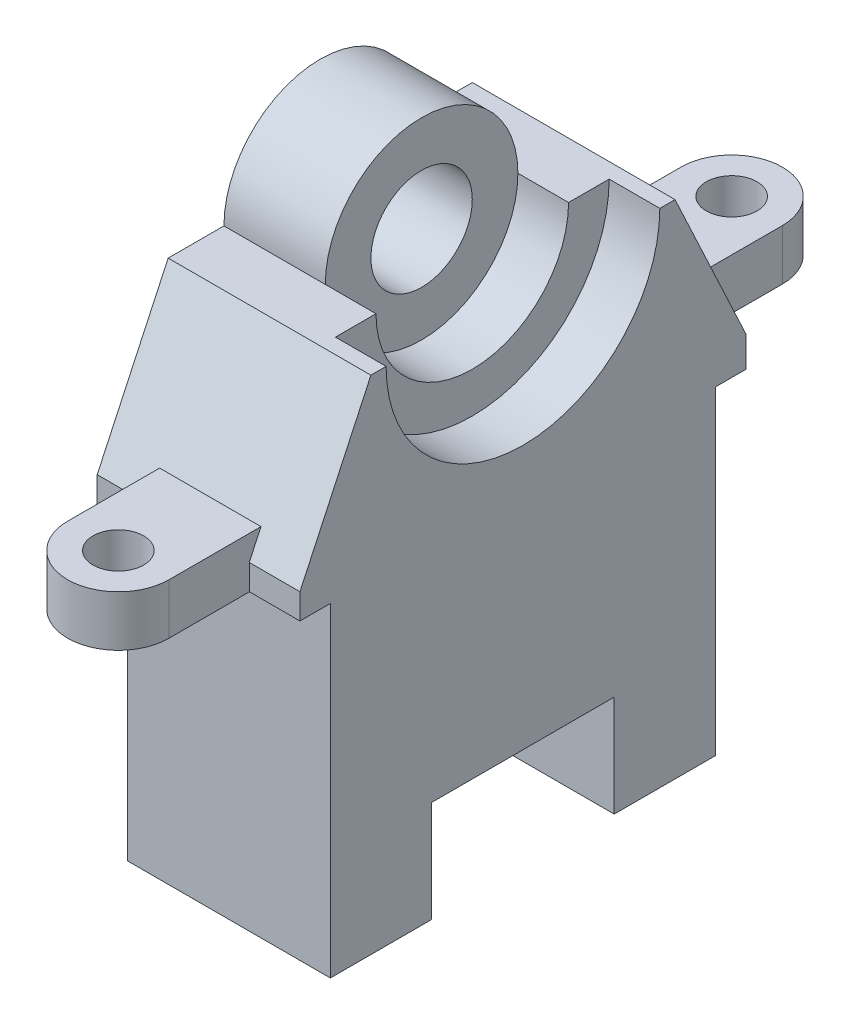
from build123d import *

# Parameters (mm, degrees)
BOSS_EXTRUDE1_DEPTH      = 40
BOSS_EXTRUDE2_DEPTH      = 110
BOSS_EXTRUDE2_DEPTH_BACK = 31
SKETCH11_R               = 5
CUT_EXTRUDE11_DEPTH      = 30
SKETCH12_R               = 5
CUT_EXTRUDE15_DEPTH      = 84
SKETCH5_W                = 36
SKETCH5_H                = 20
CUT_EXTRUDE3_DEPTH       = 43
BOSS_EXTRUDE6_DEPTH      = 40
CUT_EXTRUDE4_START       = -10
SKETCH6_R                = 27
CUT_EXTRUDE4_DEPTH       = 10
CUT_EXTRUDE7_START       = -10
CUT_EXTRUDE7_DEPTH       = 10
CUT_EXTRUDE8_START       = -20
CUT_EXTRUDE8_DEPTH       = 20
SKETCH10_R               = 10
CUT_EXTRUDE9_DEPTH       = 20


# Read off the part's stored shape, not the designer's step: Boss-Extrude6
with BuildPart() as part:
    # Sketch1 → Boss-Extrude1 (new body)
    with BuildSketch(Plane(origin=(0, 0, 0), x_dir=(0, 0, -1), z_dir=(1, 0, 0))):
        Polygon((-38.7187028, -36.676276186), (37.2812972, -36.676276186), (37.2812972, 26.323723814), (43.2812972, 26.323723814), (43.2812972, 32.323723814), (29.2812972, 62.323723814), (-30.7187028, 62.323723814), (-44.7187028, 32.323723814), (-44.7187028, 27.323723814), (-38.7187028, 27.323723814), align=None)
    extrude(amount=BOSS_EXTRUDE1_DEPTH)

    # 3DSketch1 → Boss-Extrude2 (add, two sides: drawn at the far end of the back side and taken through both)
    with BuildSketch(Plane(origin=(30, 37.289381844, 39.546748703), x_dir=(-0.8944271909999159, -0.44721359549995804, 0), z_dir=(0, 0, -1)).offset(-BOSS_EXTRUDE2_DEPTH_BACK)):
        Polygon((0, 0), (17.88854382, 8.94427191), (22.360679775, 0), (4.472135955, -8.94427191), align=None)
    extrude(amount=BOSS_EXTRUDE2_DEPTH + BOSS_EXTRUDE2_DEPTH_BACK)

    # Sketch11 → Cut-Extrude11 (cut)
    with BuildSketch(Plane(origin=(0, 37.289381844, 0), x_dir=(1, 0, 0), z_dir=(0, 1, 0))):
        with BuildLine():
            Line((20, 70.453251297), (10, 70.453251297))
            Line((10, 70.453251297), (10, 60.453251297))
            ThreePointArc((10, 60.453251297), (12.928932188, 67.524319109), (20, 70.453251297))
        make_face()
        with BuildLine():
            Line((30, 70.453251297), (20, 70.453251297))
            ThreePointArc((20, 70.453251297), (27.071067812, 67.524319109), (30, 60.453251297))
            Line((30, 60.453251297), (30, 70.453251297))
        make_face()
        with Locations(Location((20, 60.453251297, 0), (0, 0, 270))):
            Circle(SKETCH11_R)
    extrude(amount=-CUT_EXTRUDE11_DEPTH, mode=Mode.SUBTRACT)

    # Sketch12 → Cut-Extrude15 (cut)
    with BuildSketch(Plane(origin=(0, 0, 0), x_dir=(1, 0, 0), z_dir=(0, 1, 0))):
        with BuildLine():
            Line((10, -70.546748703), (20, -70.546748703))
            ThreePointArc((20, -70.546748703), (12.928932188, -67.617816515), (10, -60.546748703))
            Line((10, -60.546748703), (10, -70.546748703))
        make_face()
        with BuildLine():
            Line((20, -70.546748703), (30, -70.546748703))
            Line((30, -70.546748703), (30, -60.546748703))
            ThreePointArc((30, -60.546748703), (27.071067812, -67.617816515), (20, -70.546748703))
        make_face()
        with Locations(Location((20, -60.546748703, 0), (0, 0, 90))):
            Circle(SKETCH12_R)
    extrude(amount=CUT_EXTRUDE15_DEPTH, mode=Mode.SUBTRACT)

    # Sketch5 → Cut-Extrude3 (cut)
    with BuildSketch(Plane(origin=(40, 0, 0), x_dir=(0, 0, -1), z_dir=(1, 0, 0))):
        with Locations((-0.7187028, -26.676276186)):
            Rectangle(SKETCH5_W, SKETCH5_H)
    extrude(amount=-CUT_EXTRUDE3_DEPTH, mode=Mode.SUBTRACT)

    # Boss-Extrude6 outline → Boss-Extrude6 (add)
    with BuildSketch(Plane.YZ):
        with BuildLine():
            ThreePointArc((62.323723814, -26.2812972), (89.323723814, 0.7187028), (62.323723814, 27.7187028))
            Line((62.323723814, 27.7187028), (62.323723814, -26.2812972))
        make_face()
    extrude(amount=BOSS_EXTRUDE6_DEPTH)

    # Sketch6 → Cut-Extrude4 (cut)
    with BuildSketch(Plane(origin=(40, 0, 0), x_dir=(0, 0, -1), z_dir=(1, 0, 0)).offset(CUT_EXTRUDE4_START)):
        with Locations((-0.7187028, 62.323723814)):
            Circle(SKETCH6_R)
    extrude(amount=CUT_EXTRUDE4_DEPTH, mode=Mode.SUBTRACT)

    # Sketch8 → Cut-Extrude7 (cut)
    with BuildSketch(Plane(origin=(30, 0, 0), x_dir=(0, 0, -1), z_dir=(1, 0, 0)).offset(CUT_EXTRUDE7_START)):
        with BuildLine():
            Line((-27.7187028, 62.323723814), (-19.7187028, 62.323723814))
            ThreePointArc((-19.7187028, 62.323723814), (-0.7187028, 43.323723814), (18.2812972, 62.323723814))
            Line((18.2812972, 62.323723814), (26.2812972, 62.323723814))
            ThreePointArc((26.2812972, 62.323723814), (-0.7187028, 89.323723814), (-27.7187028, 62.323723814))
        make_face()
    extrude(amount=CUT_EXTRUDE7_DEPTH, mode=Mode.SUBTRACT)

    # Sketch9 → Cut-Extrude8 (cut)
    with BuildSketch(Plane(origin=(20, 0, 0), x_dir=(0, 0, -1), z_dir=(1, 0, 0)).offset(CUT_EXTRUDE8_START)):
        with BuildLine():
            Line((-27.7187028, 62.323723814), (-19.7187028, 62.323723814))
            ThreePointArc((-19.7187028, 62.323723814), (-0.7187028, 81.323723814), (18.2812972, 62.323723814))
            Line((18.2812972, 62.323723814), (26.2812972, 62.323723814))
            ThreePointArc((26.2812972, 62.323723814), (-0.7187028, 89.323723814), (-27.7187028, 62.323723814))
        make_face()
    extrude(amount=CUT_EXTRUDE8_DEPTH, mode=Mode.SUBTRACT)

    # Sketch10 → Cut-Extrude9 (cut)
    with BuildSketch(Plane(origin=(20, 0, 0), x_dir=(0, 0, -1), z_dir=(1, 0, 0))):
        with Locations((-0.7187028, 62.323723814)):
            Circle(SKETCH10_R)
    extrude(amount=-CUT_EXTRUDE9_DEPTH, mode=Mode.SUBTRACT)


solid = part.part
